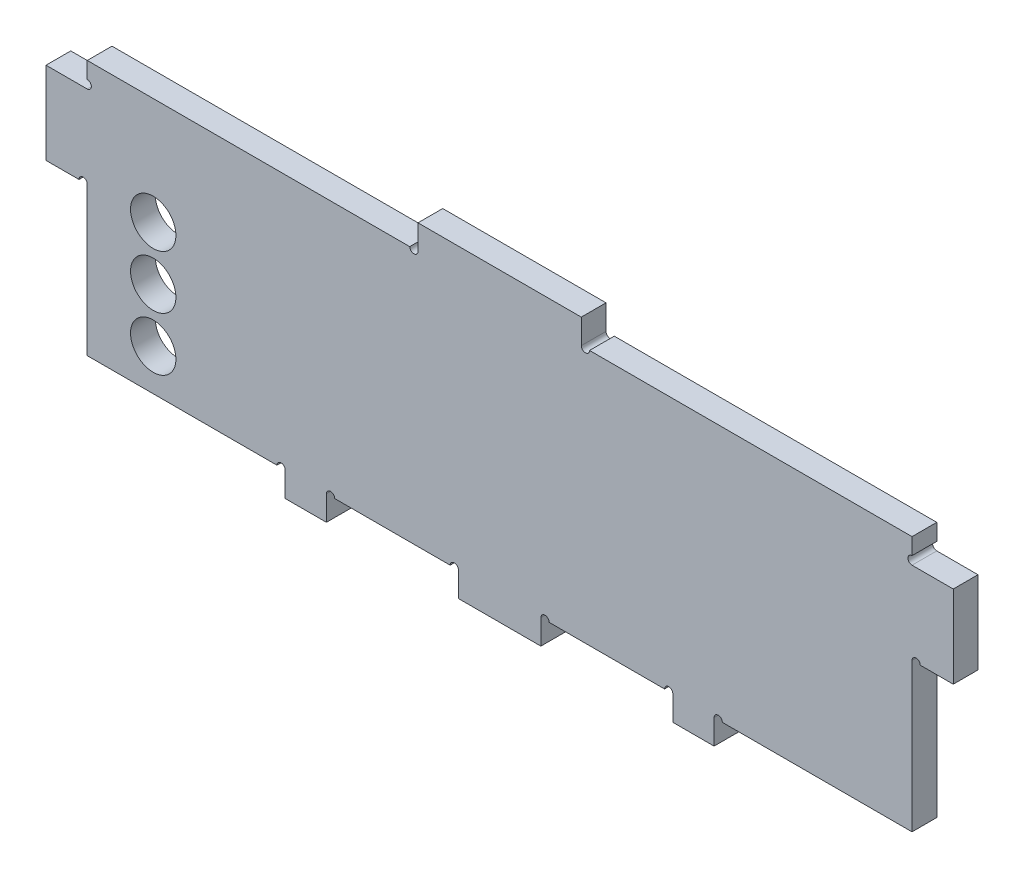
from build123d import *

# Parameters (mm, degrees)
SKETCH1_R           = 2.75
BOSS_EXTRUDE1_DEPTH = 3
SKETCH4_W           = 19.8
SKETCH4_H           = 3
BOSS_EXTRUDE2_DEPTH = 3
CUT_EXTRUDE2_DEPTH  = 67.355105305


with BuildPart() as part:
    # Sketch1 → Boss-Extrude1 (new body)
    with BuildSketch(Plane.XY):
        Polygon((-5, 0), (5, 0), (5, 3), (21, 3), (21, 0), (26, 0), (26, 3), (50, 3), (50, 21), (55, 21), (55, 31), (50, 31), (50, 34), (0, 34), (-50, 34), (-50, 31), (-55, 31), (-55, 21), (-50, 21), (-50, 3), (-26, 3), (-26, 0), (-21, 0), (-21, 3), (-5, 3), align=None)
        with Locations((-42, 8)):
            Circle(SKETCH1_R, mode=Mode.SUBTRACT)
        with Locations((-42, 14.5)):
            Circle(SKETCH1_R, mode=Mode.SUBTRACT)
        with Locations((-42, 21)):
            Circle(SKETCH1_R, mode=Mode.SUBTRACT)
    extrude(amount=BOSS_EXTRUDE1_DEPTH)

    # Sketch4 → Boss-Extrude2 (add)
    with BuildSketch(Plane.XY.offset(3)):
        with Locations((0, 35.5)):
            Rectangle(SKETCH4_W, SKETCH4_H)
    extrude(amount=-BOSS_EXTRUDE2_DEPTH)

    # Sketch3 → Cut-Extrude2 (cut, through all)
    with BuildSketch(Plane.XY.offset(3)):
        with BuildLine():
            ThreePointArc((21, 3), (20.5, 3.5), (20, 3))
            Line((20, 3), (21, 3))
        make_face()
        with BuildLine():
            ThreePointArc((6, 3), (5.5, 3.5), (5, 3))
            Line((5, 3), (6, 3))
        make_face()
        with BuildLine():
            ThreePointArc((27, 3), (26.5, 3.5), (26, 3))
            Line((26, 3), (27, 3))
        make_face()
        with BuildLine():
            ThreePointArc((51, 21), (50.5, 21.5), (50, 21))
            Line((50, 21), (51, 21))
        make_face()
        with BuildLine():
            ThreePointArc((9.9, 34), (10.4, 33.5), (10.9, 34))
            Line((10.9, 34), (9.9, 34))
        make_face()
        with BuildLine():
            ThreePointArc((50, 32), (49.5, 31.5), (50, 31))
            Line((50, 31), (50, 32))
        make_face()
        with BuildLine():
            Line((-50, 32), (-50, 31))
            ThreePointArc((-50, 31), (-49.5, 31.5), (-50, 32))
        make_face()
        with BuildLine():
            Line((-9.9, 34), (-10.9, 34))
            ThreePointArc((-10.9, 34), (-10.4, 33.5), (-9.9, 34))
        make_face()
        with BuildLine():
            Line((-51, 21), (-50, 21))
            ThreePointArc((-50, 21), (-50.5, 21.5), (-51, 21))
        make_face()
        with BuildLine():
            Line((-27, 3), (-26, 3))
            ThreePointArc((-26, 3), (-26.5, 3.5), (-27, 3))
        make_face()
        with BuildLine():
            ThreePointArc((-5, 3), (-5.5, 3.5), (-6, 3))
            Line((-6, 3), (-5, 3))
        make_face()
        with BuildLine():
            ThreePointArc((-20, 3), (-20.5, 3.5), (-21, 3))
            Line((-21, 3), (-20, 3))
        make_face()
    extrude(amount=-CUT_EXTRUDE2_DEPTH, mode=Mode.SUBTRACT)


solid = part.part
